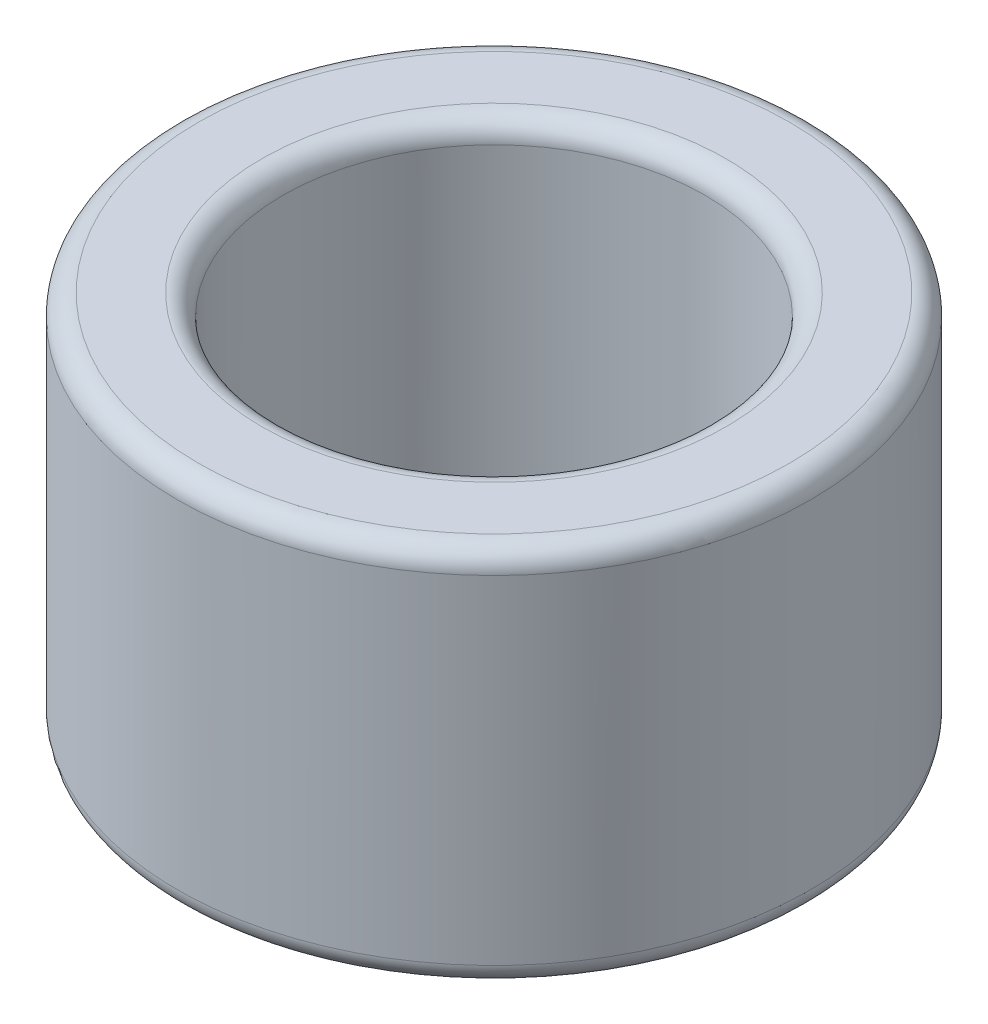
from build123d import *

# Parameters (mm, degrees)
SKETCH1_W = 1.25
SKETCH1_H = 4.5
FILLET1_R = 0.25


with BuildPart() as part:
    # Sketch1 → Revolve1 (revolve)
    with BuildSketch(Plane.XY):
        with Locations((3.125, 2.25)):
            Rectangle(SKETCH1_W, SKETCH1_H)
    revolve(axis=Axis((0, 0, 0), (0, 1, 0)))

    # Fillet1
    fillet1_edges = [part.edges().sort_by_distance(p)[0] for p in [
        (-2.5, 0, 0),
        (-3.75, 0, 0),
        (-3.75, 4.5, 0),
        (-2.5, 4.5, 0),
    ]]
    fillet(fillet1_edges, radius=FILLET1_R)


solid = part.part
